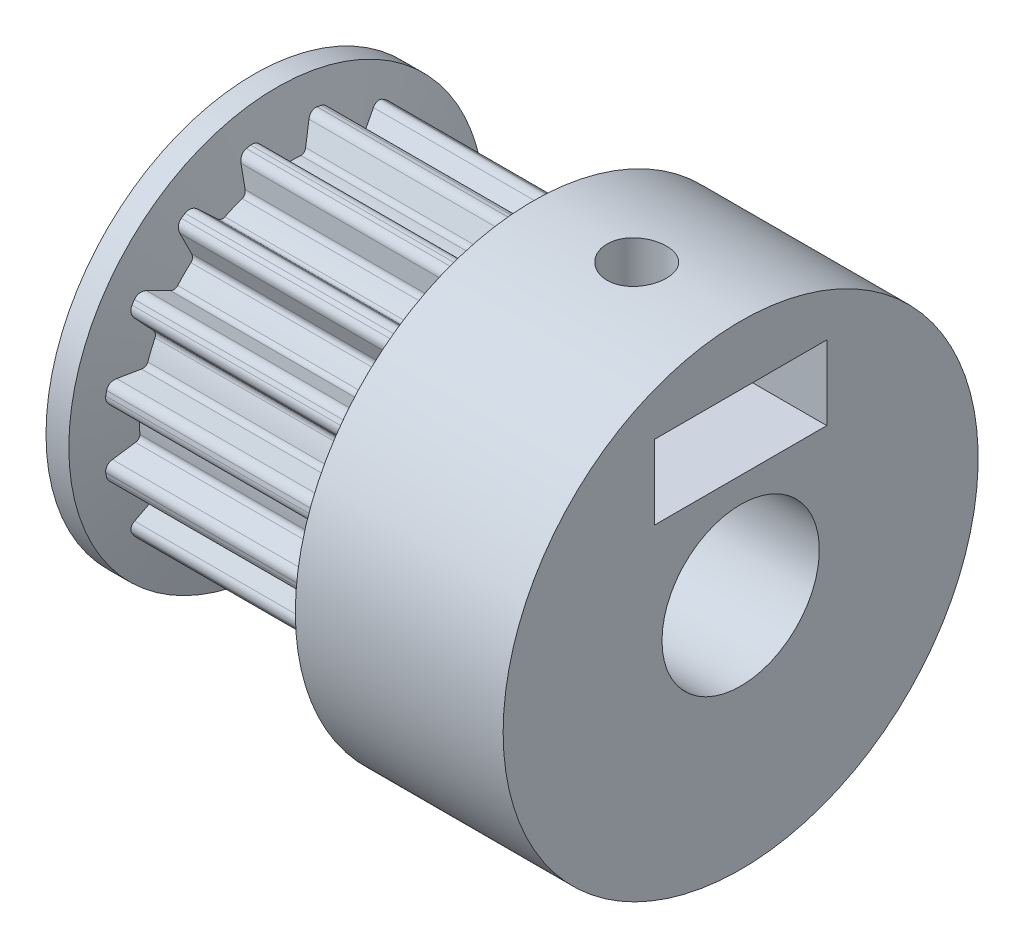
from build123d import *

# Parameters (mm, degrees)
SKETCH2_W          = 9
SKETCH2_H          = 6.1
COG_DEPTH          = 13.466755793
PATTERN_COG_COUNT  = 16
SKETCH3_W          = 7
SKETCH3_H          = 8
SKETCH8_W          = 16
SKETCH8_H          = 2.65
SKETCH15_W         = 1
SKETCH15_H         = 197.35
CUT_EXTRUDE1_DEPTH = 2.5


with BuildPart() as part:
    # Sketch2 → Body (revolve)
    with BuildSketch(Plane.XY):
        with Locations((4.5, 3.05)):
            Rectangle(SKETCH2_W, SKETCH2_H)
    revolve(axis=Axis((0, 0, 0), (1, 0, 0)))

    # Sketch6 → Cog (cut, through all)
    with BuildSketch(Plane(origin=(0, 0, 0), x_dir=(0, 0, -1), z_dir=(1, 0, 0))):
        with BuildLine():
            Line((0.789835397, 5.82877936), (0.508392514, 5.225223151))
            ThreePointArc((0.508392514, 5.225223151), (0.429351309, 5.137842761), (0.314832372, 5.1101253))
            ThreePointArc((0.314832372, 5.1101253), (0, 5.11981445), (-0.314832372, 5.1101253))
            ThreePointArc((-0.314832372, 5.1101253), (-0.429351309, 5.137842761), (-0.508392514, 5.225223151))
            Line((-0.508392514, 5.225223151), (-0.789835397, 5.82877936))
            ThreePointArc((-0.789835397, 5.82877936), (-0.924476923, 5.968756351), (-1.116644684, 5.996924599))
            ThreePointArc((-1.116644684, 5.996924599), (0, 6.1), (1.116644684, 5.996924599))
            ThreePointArc((1.116644684, 5.996924599), (0.924476923, 5.968756351), (0.789835397, 5.82877936))
        make_face()
    cog = extrude(amount=COG_DEPTH, mode=Mode.SUBTRACT)

    # Pattern-Cog: Cog ×16 about axis
    pattern_cog_axis = Axis((0, 0, 0), (1, 0, 0))
    for i in range(1, PATTERN_COG_COUNT):
        add(cog.rotate(pattern_cog_axis, i * 360 / PATTERN_COG_COUNT), mode=Mode.SUBTRACT)

    # Sketch3 → Hub (revolve)
    with BuildSketch(Plane.XY):
        with Locations((12.5, 4)):
            Rectangle(SKETCH3_W, SKETCH3_H)
    revolve(axis=Axis((0, 0, 0), (1, 0, 0)))

    # Sketch8 → Hole-Shaft (revolve, cut)
    with BuildSketch(Plane.XY):
        with Locations((8, -1.325)):
            Rectangle(SKETCH8_W, SKETCH8_H)
    revolve(axis=Axis((0, 0, 0), (1, 0, 0)), mode=Mode.SUBTRACT)

    # Sketch15 → Stop-Screw (revolve, cut)
    with BuildSketch(Plane.XY):
        with Locations((13, 98.675)):
            Rectangle(SKETCH15_W, SKETCH15_H)
    revolve(axis=Axis((12.5, 197.35, 0), (0, -1, 0)), mode=Mode.SUBTRACT)

    # Sketch16 → Flange-Left (revolve)
    with BuildSketch(Plane.XY):
        Polygon((0, 2.542315139), (-0.39810301, 2.542315139), (-0.39810301, 7), (0.370293839, 7), (1.10189699, 4.269619869), (1.10189699, 2.542315139), align=None)
    revolve(axis=Axis((0, 0, 0), (1, 0, 0)))

    # Sketch18 → Cut-Extrude1 (cut)
    with BuildSketch(Plane(origin=(0, 3.5, 0), x_dir=(-1, 0, 0), z_dir=(0, 1, 0))):
        Polygon((-16.41744749, 2.9), (-16.41744749, -2.9), (-10.825684219, -2.9), (-9.151368439, 0), (-10.825684219, 2.9), align=None)
    extrude(amount=CUT_EXTRUDE1_DEPTH, mode=Mode.SUBTRACT)


solid = part.part
